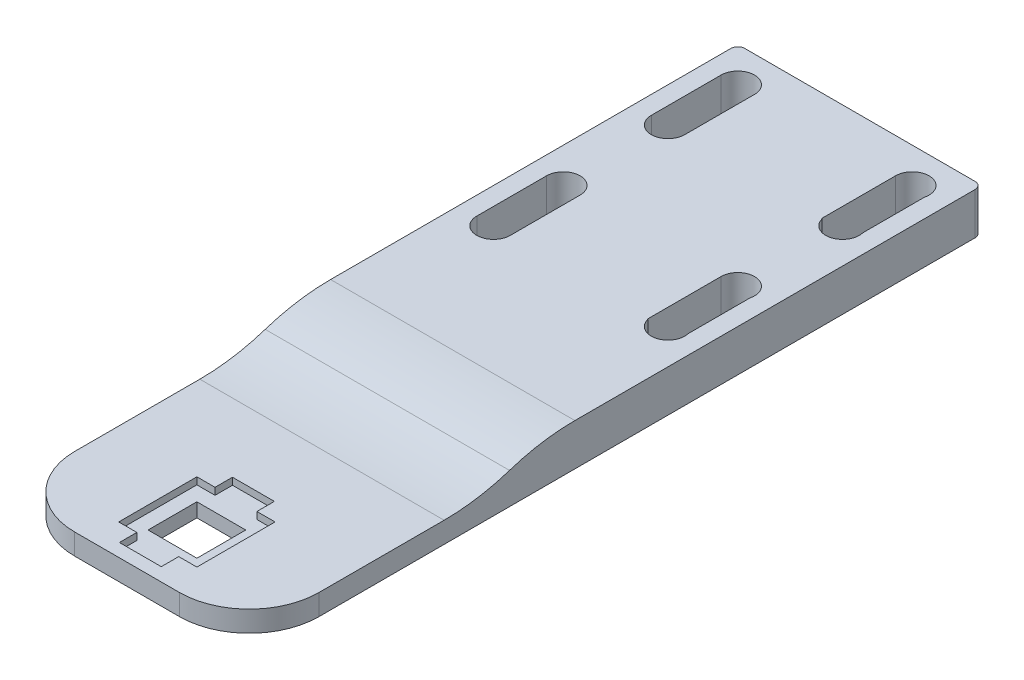
from build123d import *

# Parameters (mm, degrees)
SKETCH1_W            = 35
SKETCH1_H            = 105
BOSS_EXTRUDE1_DEPTH  = 6
M4_CLEARANCE_HOLE1_D = 4.8
LPATTERN2_COUNT      = 2
LPATTERN2_PITCH      = 10
SKETCH5_W            = 4.8
SKETCH5_H            = 10
SKETCH5_W_2          = 4.730666207
SKETCH5_H_2          = 10.572708501
CUT_EXTRUDE1_DEPTH   = 88.085432636
SKETCH6_W            = 11.2
SKETCH6_H            = 11.2
CUT_EXTRUDE2_DEPTH   = 4
SKETCH7_W            = 7
SKETCH7_H            = 7
CUT_EXTRUDE3_DEPTH   = 87.970527062
SKETCH8_W            = 6
SKETCH8_H            = 16.2
CUT_EXTRUDE4_DEPTH   = 4
FILLET1_R            = 10
CUT_EXTRUDE5_START   = -6
SKETCH9_W            = 37.049954943
SKETCH9_H            = 41
CUT_EXTRUDE5_DEPTH   = 3
FILLET2_R            = 30
FILLET3_R            = 30
FILLET4_R            = 1


with BuildPart() as part:
    # Sketch1 → Boss-Extrude1 (new body)
    with BuildSketch(Plane(origin=(0, 0, 0), x_dir=(1, 0, 0), z_dir=(0, 1, 0))):
        with Locations((0.111940299, -32.574626866)):
            Rectangle(SKETCH1_W, SKETCH1_H)
    extrude(amount=BOSS_EXTRUDE1_DEPTH)

    # M4 Clearance Hole1 (through all)
    with Locations(Plane(origin=(0, 6, 0), x_dir=(1, 0, 0), z_dir=(0, 1, 0))):
        with Locations((-12.388059701, 14.925373134), (12.611940299, 14.925373134), (12.611940299, -10.074626866), (-12.388059701, -10.074626866)):
            m4_clearance_hole1 = Hole(M4_CLEARANCE_HOLE1_D / 2)

    # LPattern2: M4 Clearance Hole1 ×2
    with Locations(*[(0, 0, i * LPATTERN2_PITCH) for i in range(1, LPATTERN2_COUNT)]):
        add(m4_clearance_hole1, mode=Mode.SUBTRACT)

    # Sketch5 → Cut-Extrude1 (cut, through all)
    with BuildSketch(Plane(origin=(0, 6, 0), x_dir=(1, 0, 0), z_dir=(0, 1, 0))):
        with Locations((-12.388059701, 9.925373134)):
            Rectangle(SKETCH5_W, SKETCH5_H)
        with Locations((-12.388059701, -15.074626866)):
            Rectangle(SKETCH5_W, SKETCH5_H)
        with Locations((12.577273403, 9.639018884)):
            Rectangle(SKETCH5_W_2, SKETCH5_H_2)
        with Locations((12.577273403, -15.360981116)):
            Rectangle(SKETCH5_W_2, SKETCH5_H_2)
    extrude(amount=-CUT_EXTRUDE1_DEPTH, mode=Mode.SUBTRACT)

    # Sketch6 → Cut-Extrude2 (cut)
    with BuildSketch(Plane(origin=(0, 6, 0), x_dir=(1, 0, 0), z_dir=(0, 1, 0))):
        with Locations((0.111940299, -75.074626866)):
            Rectangle(SKETCH6_W, SKETCH6_H)
    extrude(amount=-CUT_EXTRUDE2_DEPTH, mode=Mode.SUBTRACT)

    # Sketch7 → Cut-Extrude3 (cut, through all)
    with BuildSketch(Plane(origin=(0, 2, 0), x_dir=(1, 0, 0), z_dir=(0, 1, 0))):
        with Locations((0.111940299, -75.074626866)):
            Rectangle(SKETCH7_W, SKETCH7_H)
    extrude(amount=-CUT_EXTRUDE3_DEPTH, mode=Mode.SUBTRACT)

    # Sketch8 → Cut-Extrude4 (cut)
    with BuildSketch(Plane(origin=(0, 6, 0), x_dir=(1, 0, 0), z_dir=(0, 1, 0))):
        with Locations((0.111940299, -75.074626866)):
            Rectangle(SKETCH8_W, SKETCH8_H)
    extrude(amount=-CUT_EXTRUDE4_DEPTH, mode=Mode.SUBTRACT)

    # Fillet1
    fillet1_edges = [part.edges().sort_by_distance(p)[0] for p in [
        (17.611940299, 3, 85.074626866),
        (-17.388059701, 3, 85.074626866),
    ]]
    fillet(fillet1_edges, radius=FILLET1_R)

    # Sketch9 → Cut-Extrude5 (cut)
    with BuildSketch(Plane.XZ.offset(CUT_EXTRUDE5_START)):
        with Locations((1.136917771, 64.574626866)):
            Rectangle(SKETCH9_W, SKETCH9_H)
    extrude(amount=CUT_EXTRUDE5_DEPTH, mode=Mode.SUBTRACT)

    # Fillet2
    # the kernel refuses this fillet: 30 mm, written as the material it adds along each edge
    with BuildSketch(Plane(origin=(-17.388059701, 3, 44.074626866), x_dir=(0, 1, 0), z_dir=(1, 0, 0))) as fillet2_piece_1:
        with BuildLine():
            CenterArc((30, 13.076696831), FILLET2_R, 180, 25.841932763)
            Line((0, 13.076696831), (-0.6, 13.076696831))
            Line((-0.6, 13.076696831), (-0.6, 0))
            Line((-0.6, 0), (0, -0.6))
            ThreePointArc((0, -0.6), (1.5, -0.6), (2.46, -0.261533937))
            Line((2.46, -0.261533937), (3, 0))
        make_face()
    extrude(amount=35)

    # Fillet3
    fillet3_edges = [part.edges().sort_by_distance(p)[0] for p in [
        (0.111940299, 6, 44.074626866),
    ]]
    fillet(fillet3_edges, radius=FILLET3_R)

    # Fillet4
    fillet4_edges = [part.edges().sort_by_distance(p)[0] for p in [
        (-17.388059701, 3, -19.925373134),
        (17.611940299, 3, -19.925373134),
    ]]
    fillet(fillet4_edges, radius=FILLET4_R)


solid = part.part
